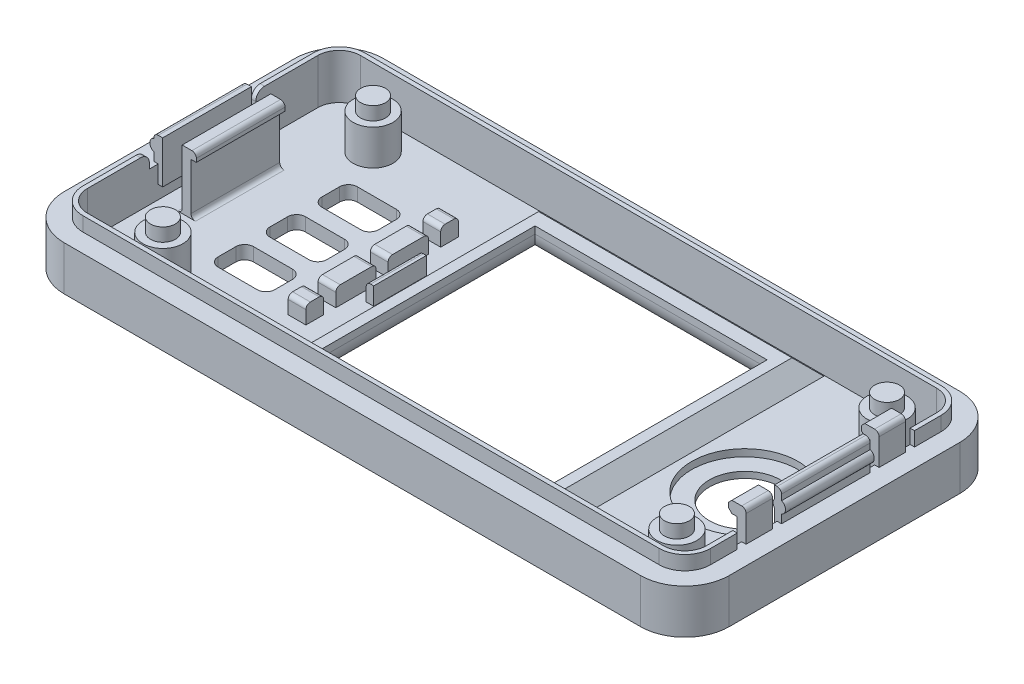
from build123d import *

# Parameters (mm, degrees)
EXTRUDE_2_DEPTH          = 5
EXTRUDE_4_DEPTH          = 1.6
SKETCH_7_W               = 0.5
SKETCH_7_H               = 10
EXTRUDE_8_DEPTH          = 2.8
SKETCH_8_R               = 0.7
EXTRUDE_9_DEPTH          = 10
FILLET_1_R               = 0.5
SKETCH_11_W              = 1
SKETCH_11_H              = 1.6
CUT_EXTRUDE_1_DEPTH      = 1.2
FILLET_2_R               = 1
SKETCH_13_W              = 0.5
SKETCH_13_H              = 10
EXTRUDE_10_DEPTH         = 2.8
CUT_EXTRUDE_START        = -3.5
CUT_EXTRUDE_2_DEPTH      = 3.5
SKETCH_13_2_W            = 0.5
SKETCH_13_2_H            = 10
EXTRUDE_11_DEPTH         = 2
EXTRUDE_12_DEPTH         = 1.6
EXTRUDE_12_DEPTH_BACK    = 2
SKETCH_5_W               = 0.3
SKETCH_5_H               = 10
SKETCH_15_R              = 2.25
EXTRUDE_13_DEPTH         = 4
SKETCH_16_R              = 1.4
EXTRUDE_14_DEPTH         = 1.5
SKETCH_17_W              = 0.5
SKETCH_17_H              = 1
CUT_EXTRUDE_3_DEPTH      = 1.6
SKETCH_19_W              = 0.8
SKETCH_19_H              = 10
EXTRUDE_15_DEPTH         = 1.8
SKETCH_20_R              = 0.7
EXTRUDE_16_DEPTH         = 10
FILLET_4_R               = 0.5
SKETCH_21_W              = 0.5
SKETCH_21_H              = 3
EXTRUDE_17_DEPTH         = 1.9
SKETCH_22_W              = 3
SKETCH_22_H              = 6.3
EXTRUDE_23_DEPTH         = 0.5
FILLET_12_R              = 0.5
SKETCH_29_W              = 0.5
SKETCH_29_H              = 1
CUT_EXTRUDE_5_DEPTH      = 1.6
SKETCH_30_W              = 3
SKETCH_30_H              = 1.3
EXTRUDE_26_DEPTH         = 1
CHAMFER_7_SIZE           = 0.4
SKETCH_24_W              = 1
SKETCH_24_H              = 10
EXTRUDE_27_DEPTH         = 6.7
FILLET_14_R              = 0.5
SKETCH_31_W              = 10
SKETCH_31_H              = 0.9
EXTRUDE_29_DEPTH         = 0.6
FILLET_15_R              = 0.5
SKETCH_27_W              = 28.571240274
SKETCH_27_H              = 28.5
EXTRUDE_31_DEPTH         = 1.8
CUT_EXTRUDE_6_DEPTH      = 1.8
CUT_EXTRUDE_6_DEPTH_BACK = 1.5
SKETCH_26_W              = 26.171240274
SKETCH_26_H              = 25.4
CUT_EXTRUDE_7_DEPTH      = 1.5
SKETCH_33_R              = 6
CUT_EXTRUDE_8_DEPTH      = 0.8
SKETCH_34_R              = 4
CUT_EXTRUDE_9_DEPTH      = 0.8
SKETCH_35_W              = 2
SKETCH_35_H              = 4.55
SKETCH_35_H_2            = 2
SKETCH_35_W_2            = 0.85
SKETCH_35_H_3            = 5.933560664
EXTRUDE_32_DEPTH         = 2
FILLET_16_R              = 0.5
CUT_EXTRUDE_START_2      = -0.5
CUT_EXTRUDE_11_DEPTH     = 0.5
FILLET_17_R              = 2.5


# Read off the part's stored shape, not the designer's step: 切除-拉伸11
# Some blends are built 0.0001 mm under size
with BuildPart() as part:
    # case 2 → 凸台-拉伸2 (new body)
    with BuildSketch(Plane(origin=(0, 0, 0), x_dir=(1, 0, 0), z_dir=(0, 1, 0))):
        with BuildLine():
            Line((-34.042196447, 18), (30.957803553, 18))
            ThreePointArc((30.957803553, 18), (34.493337459, 16.535533906), (35.957803553, 13))
            Line((35.957803553, 13), (35.957803553, -13))
            ThreePointArc((35.957803553, -13), (34.493337459, -16.535533906), (30.957803553, -18))
            Line((30.957803553, -18), (-34.042196447, -18))
            ThreePointArc((-34.042196447, -18), (-37.577730353, -16.535533906), (-39.042196447, -13))
            Line((-39.042196447, -13), (-39.042196447, 13))
            ThreePointArc((-39.042196447, 13), (-37.577730353, 16.535533906), (-34.042196447, 18))
        make_face()
    extrude(amount=EXTRUDE_2_DEPTH)

    # 草图3 → 凸台-拉伸4 (add)
    with BuildSketch(Plane(origin=(0, 5, 0), x_dir=(1, 0, 0), z_dir=(0, 1, 0))):
        with BuildLine():
            Line((-36.942196447, 13), (-36.942196447, -13))
            ThreePointArc((-36.942196447, -13), (-36.092806113, -15.050609665), (-34.042196447, -15.9))
            Line((-34.042196447, -15.9), (30.957803553, -15.9))
            ThreePointArc((30.957803553, -15.9), (33.008413218, -15.050609665), (33.857803553, -13))
            Line((33.857803553, -13), (33.857803553, 13))
            ThreePointArc((33.857803553, 13), (33.008413218, 15.050609665), (30.957803553, 15.9))
            Line((30.957803553, 15.9), (-34.042196447, 15.9))
            ThreePointArc((-34.042196447, 15.9), (-36.092806113, 15.050609665), (-36.942196447, 13))
        make_face()
        with BuildLine():
            Line((-34.042196447, -15.4), (30.957803553, -15.4))
            ThreePointArc((30.957803553, -15.4), (32.654859828, -14.697056275), (33.357803553, -13))
            Line((33.357803553, -13), (33.357803553, 13))
            ThreePointArc((33.357803553, 13), (32.654859828, 14.697056275), (30.957803553, 15.4))
            Line((30.957803553, 15.4), (-34.042196447, 15.4))
            ThreePointArc((-34.042196447, 15.4), (-35.739252722, 14.697056275), (-36.442196447, 13))
            Line((-36.442196447, 13), (-36.442196447, -13))
            ThreePointArc((-36.442196447, -13), (-35.739252722, -14.697056275), (-34.042196447, -15.4))
        make_face(mode=Mode.SUBTRACT)
    extrude(amount=EXTRUDE_4_DEPTH)

    # 草图7 → 凸台-拉伸8 (add)
    with BuildSketch(Plane(origin=(0, 5, 0), x_dir=(1, 0, 0), z_dir=(0, 1, 0))):
        with Locations((-36.692196447, 0)):
            Rectangle(SKETCH_7_W, SKETCH_7_H)
    extrude(amount=EXTRUDE_8_DEPTH)

    # 草图8 → 凸台-拉伸9 (add)
    with BuildSketch(Plane.XY.offset(5)):
        with Locations((-36.692196447, 6.6)):
            Circle(SKETCH_8_R)
    extrude(amount=-EXTRUDE_9_DEPTH)

    # 圆角1
    fillet_1_edges = [part.edges().sort_by_distance(p)[0] for p in [
        (-36.942196447, 7.8, 0),
    ]]
    fillet(fillet_1_edges, radius=FILLET_1_R - 0.0001)  # a hair under: the kernel refuses the full size

    # 草图11 → 切除-拉伸1 (cut)
    with BuildSketch(Plane.ZY.offset(36.942196447)):
        with Locations((5.5, 5.8)):
            Rectangle(SKETCH_11_W, SKETCH_11_H)
        with Locations((-5.5, 5.8)):
            Rectangle(SKETCH_11_W, SKETCH_11_H)
    extrude(amount=-CUT_EXTRUDE_1_DEPTH, mode=Mode.SUBTRACT)

    # 圆角2
    fillet_2_edges = [part.edges().sort_by_distance(p)[0] for p in [
        (-36.692196447, 6.6, 6),
        (-36.692196447, 6.6, -6),
    ]]
    fillet(fillet_2_edges, radius=FILLET_2_R)

    # 草图13 → 凸台-拉伸10 (add)
    with BuildSketch(Plane(origin=(0, 5, 0), x_dir=(1, 0, 0), z_dir=(0, 1, 0))):
        with Locations((-36.192196447, 0)):
            Rectangle(SKETCH_13_W, SKETCH_13_H)
    extrude(amount=EXTRUDE_10_DEPTH)

    # 草图14 → 切除-拉伸2 (cut)
    with BuildSketch(Plane(origin=(0, 5, 0), x_dir=(1, 0, 0), z_dir=(0, 1, 0)).offset(CUT_EXTRUDE_START)):
        with BuildLine():
            Line((-34.042196447, -15.4), (30.957803553, -15.4))
            ThreePointArc((30.957803553, -15.4), (32.654859828, -14.697056275), (33.357803553, -13))
            Line((33.357803553, -13), (33.357803553, 13))
            ThreePointArc((33.357803553, 13), (32.654859828, 14.697056275), (30.957803553, 15.4))
            Line((30.957803553, 15.4), (-34.042196447, 15.4))
            ThreePointArc((-34.042196447, 15.4), (-35.739252722, 14.697056275), (-36.442196447, 13))
            Line((-36.442196447, 13), (-36.442196447, -13))
            ThreePointArc((-36.442196447, -13), (-35.739252722, -14.697056275), (-34.042196447, -15.4))
        make_face()
    extrude(amount=CUT_EXTRUDE_2_DEPTH, mode=Mode.SUBTRACT)

    # 草图13<2> → 凸台-拉伸11 (add)
    with BuildSketch(Plane(origin=(0, 5, 0), x_dir=(1, 0, 0), z_dir=(0, 1, 0))):
        with Locations((-36.192196447, 0)):
            Rectangle(SKETCH_13_2_W, SKETCH_13_2_H)
    extrude(amount=-EXTRUDE_11_DEPTH)

    # 草图5 → 凸台-拉伸12 (add, two sides: drawn at the far end of the back side and taken through both)
    with BuildSketch(Plane(origin=(0, 5, 0), x_dir=(1, 0, 0), z_dir=(0, 1, 0)).offset(-EXTRUDE_12_DEPTH_BACK)):
        with Locations((33.207803553, 0)):
            Rectangle(SKETCH_5_W, SKETCH_5_H)
    extrude(amount=EXTRUDE_12_DEPTH + EXTRUDE_12_DEPTH_BACK)

    # 草图15 → 凸台-拉伸13 (add)
    with BuildSketch(Plane(origin=(0, 1.5, 0), x_dir=(1, 0, 0), z_dir=(0, 1, 0))):
        with Locations(Location((28.957803553, -11.9, 0), (0, 0, 270))):
            Circle(SKETCH_15_R)
        with Locations(Location((-29.012994719, -11.9, 0), (0, 0, 270))):
            Circle(SKETCH_15_R)
        with Locations(Location((28.957803553, 11.8, 0), (0, 0, 270))):
            Circle(SKETCH_15_R)
        with Locations(Location((-29.012994719, 11.8, 0), (0, 0, 270))):
            Circle(SKETCH_15_R)
    extrude(amount=EXTRUDE_13_DEPTH)

    # 草图16 → 凸台-拉伸14 (add)
    with BuildSketch(Plane(origin=(0, 5.5, 0), x_dir=(1, 0, 0), z_dir=(0, 1, 0))):
        with Locations(Location((28.957803553, -11.9, 0), (0, 0, 270))):
            Circle(SKETCH_16_R)
        with Locations(Location((28.957803553, 11.8, 0), (0, 0, 270))):
            Circle(SKETCH_16_R)
        with Locations(Location((-29.012994719, -11.9, 0), (0, 0, 270))):
            Circle(SKETCH_16_R)
        with Locations(Location((-29.012994719, 11.8, 0), (0, 0, 270))):
            Circle(SKETCH_16_R)
    extrude(amount=EXTRUDE_14_DEPTH)

    # 草图17 → 切除-拉伸3 (cut)
    with BuildSketch(Plane(origin=(0, 6.6, 0), x_dir=(1, 0, 0), z_dir=(0, 1, 0))):
        with Locations((33.607803553, -5.5)):
            Rectangle(SKETCH_17_W, SKETCH_17_H)
        with Locations((33.607803553, 5.5)):
            Rectangle(SKETCH_17_W, SKETCH_17_H)
    extrude(amount=-CUT_EXTRUDE_3_DEPTH, mode=Mode.SUBTRACT)

    # 草图19 → 凸台-拉伸15 (add)
    with BuildSketch(Plane(origin=(0, 6.6, 0), x_dir=(1, 0, 0), z_dir=(0, 1, 0))):
        with Locations((33.457803553, 0)):
            Rectangle(SKETCH_19_W, SKETCH_19_H)
    extrude(amount=EXTRUDE_15_DEPTH)

    # 草图20 → 凸台-拉伸16 (add)
    with BuildSketch(Plane(origin=(0, 0, -5), x_dir=(-1, 0, 0), z_dir=(0, 0, -1))):
        with Locations((-33.607803553, 6.6)):
            Circle(SKETCH_20_R)
    extrude(amount=-EXTRUDE_16_DEPTH)

    # 圆角4
    fillet_4_edges = [part.edges().sort_by_distance(p)[0] for p in [
        (33.857803553, 8.4, 0),
    ]]
    fillet(fillet_4_edges, radius=FILLET_4_R)

    # 草图21 → 凸台-拉伸17 (add)
    with BuildSketch(Plane(origin=(0, 6.6, 0), x_dir=(1, 0, 0), z_dir=(0, 1, 0))):
        with Locations((33.607803553, -7.5)):
            Rectangle(SKETCH_21_W, SKETCH_21_H)
        with Locations((33.607803553, 7.5)):
            Rectangle(SKETCH_21_W, SKETCH_21_H)
    extrude(amount=EXTRUDE_17_DEPTH)

    # 草图22 → 凸台-拉伸23 (add)
    with BuildSketch(Plane.ZY.offset(-33.357803553)):
        with Locations((-7.5, 5.35)):
            Rectangle(SKETCH_22_W, SKETCH_22_H)
        with Locations((7.5, 5.35)):
            Rectangle(SKETCH_22_W, SKETCH_22_H)
    extrude(amount=EXTRUDE_23_DEPTH)

    # 圆角12
    fillet_12_edges = [part.edges().sort_by_distance(p)[0] for p in [
        (33.857803553, 8.5, 7.5),
        (33.857803553, 8.5, -7.5),
    ]]
    fillet(fillet_12_edges, radius=FILLET_12_R)

    # 草图29 → 切除-拉伸5 (cut)
    with BuildSketch(Plane(origin=(0, 6.6, 0), x_dir=(1, 0, 0), z_dir=(0, 1, 0))):
        with Locations((33.607803553, -9.5)):
            Rectangle(SKETCH_29_W, SKETCH_29_H)
        with Locations((33.607803553, 9.5)):
            Rectangle(SKETCH_29_W, SKETCH_29_H)
    extrude(amount=-CUT_EXTRUDE_5_DEPTH, mode=Mode.SUBTRACT)

    # 草图30 → 凸台-拉伸26 (add)
    with BuildSketch(Plane.ZY.offset(-32.857803553)):
        with Locations((7.5, 7.85)):
            Rectangle(SKETCH_30_W, SKETCH_30_H)
        with Locations((-7.5, 7.85)):
            Rectangle(SKETCH_30_W, SKETCH_30_H)
    extrude(amount=EXTRUDE_26_DEPTH)

    # 倒角7
    chamfer_7_edges = [part.edges().sort_by_distance(p)[0] for p in [
        (31.857803553, 7.2, 7.5),
        (31.857803553, 8.5, 7.5),
        (31.857803553, 7.2, -7.5),
        (31.857803553, 8.5, -7.5),
    ]]
    chamfer(chamfer_7_edges, length=CHAMFER_7_SIZE)

    # 草图24 → 凸台-拉伸27 (add)
    with BuildSketch(Plane(origin=(0, 1.5, 0), x_dir=(1, 0, 0), z_dir=(0, 1, 0))):
        with Locations((-33.242196447, 0)):
            Rectangle(SKETCH_24_W, SKETCH_24_H)
    extrude(amount=EXTRUDE_27_DEPTH)

    # 圆角14
    fillet_14_edges = [part.edges().sort_by_distance(p)[0] for p in [
        (-33.742196447, 1.5, 0),
        (-32.742196447, 1.5, 0),
    ]]
    fillet(fillet_14_edges, radius=FILLET_14_R)

    # 草图31 → 凸台-拉伸29 (add)
    with BuildSketch(Plane(origin=(-32.742196447, 0, 0), x_dir=(0, 0, -1), z_dir=(1, 0, 0))):
        with Locations((0, 7.75)):
            Rectangle(SKETCH_31_W, SKETCH_31_H)
    extrude(amount=EXTRUDE_29_DEPTH)

    # 圆角15
    fillet_15_edges = [part.edges().sort_by_distance(p)[0] for p in [
        (-32.142196447, 8.2, 0),
    ]]
    fillet(fillet_15_edges, radius=FILLET_15_R)

    # 草图27 → 凸台-拉伸31 (add)
    with BuildSketch(Plane(origin=(0, 1.5, 0), x_dir=(1, 0, 0), z_dir=(0, 1, 0))):
        with Locations((2.24342369, -0.75)):
            Rectangle(SKETCH_27_W, SKETCH_27_H)
    extrude(amount=EXTRUDE_31_DEPTH)

    # 倒角8
    # the kernel refuses this chamfer: 1.8 mm, written as the material it adds along each edge
    with BuildSketch(Plane(origin=(16.529043827, 1.5, -13.5), x_dir=(0, -0.027495876610586382, -0.9996219169112966), z_dir=(-1, 0, 0))) as chamfer_8_piece_1_section:
        with BuildLine():
            Line((1.851611751, 0), (-0.101784879, -1.848812028))
            Line((-0.101784879, -1.848812028), (-0.137771268, -1.847822177))
            ThreePointArc((-0.137771268, -1.847822177), (-0.061432609, -0.924116093), (-0.035986389, 0.000989852))
            Line((-0.035986389, 0.000989852), (0.000989852, 0.035986389))
            ThreePointArc((0.000989852, 0.035986389), (0.926095796, 0.010540169), (1.852601603, 0.035986389))
            Line((1.852601603, 0.035986389), (1.851611751, 0))
        make_face()
    chamfer_8_piece_1 = extrude(amount=28.571240274, mode=Mode.PRIVATE)
    chamfer_8_piece_1 = split(chamfer_8_piece_1, bisect_by=Plane(origin=(2.24342369, 3.3, -14.094727478), z_dir=(0, -1, 0)), keep=Keep.TOP, mode=Mode.PRIVATE)
    add(chamfer_8_piece_1)
    with BuildSketch(Plane(origin=(16.529043827, 1.5, 15), x_dir=(0.9996219169112966, -0.027495876610586382, 0), z_dir=(0, 0, -1))) as chamfer_8_piece_2_section:
        with BuildLine():
            Line((1.851611751, 0), (-0.101784879, -1.848812028))
            Line((-0.101784879, -1.848812028), (-0.137771268, -1.847822177))
            ThreePointArc((-0.137771268, -1.847822177), (-0.061432609, -0.924116093), (-0.035986389, 0.000989852))
            Line((-0.035986389, 0.000989852), (0.000989852, 0.035986389))
            ThreePointArc((0.000989852, 0.035986389), (0.926095796, 0.010540169), (1.852601603, 0.035986389))
            Line((1.852601603, 0.035986389), (1.851611751, 0))
        make_face()
    chamfer_8_piece_2 = extrude(amount=28.5, mode=Mode.PRIVATE)
    chamfer_8_piece_2 = split(chamfer_8_piece_2, bisect_by=Plane(origin=(17.123771305, 3.3, 0.75), z_dir=(0, -1, 0)), keep=Keep.TOP, mode=Mode.PRIVATE)
    add(chamfer_8_piece_2)
    with BuildSketch(Plane(origin=(-12.042196447, 1.5, 15), x_dir=(0, -0.027495876610586382, 0.9996219169112966), z_dir=(1, 0, 0))) as chamfer_8_piece_3_section:
        with BuildLine():
            Line((1.851611751, 0), (-0.101784879, -1.848812028))
            Line((-0.101784879, -1.848812028), (-0.137771268, -1.847822177))
            ThreePointArc((-0.137771268, -1.847822177), (-0.061432609, -0.924116093), (-0.035986389, 0.000989852))
            Line((-0.035986389, 0.000989852), (0.000989852, 0.035986389))
            ThreePointArc((0.000989852, 0.035986389), (0.926095796, 0.010540169), (1.852601603, 0.035986389))
            Line((1.852601603, 0.035986389), (1.851611751, 0))
        make_face()
    chamfer_8_piece_3 = extrude(amount=28.571240274, mode=Mode.PRIVATE)
    chamfer_8_piece_3 = split(chamfer_8_piece_3, bisect_by=Plane(origin=(2.24342369, 3.3, 15.594727478), z_dir=(0, -1, 0)), keep=Keep.TOP, mode=Mode.PRIVATE)
    add(chamfer_8_piece_3)
    with BuildSketch(Plane(origin=(-12.042196447, 1.5, -13.5), x_dir=(-0.9996219169112966, -0.027495876610586382, 0), z_dir=(0, 0, 1))) as chamfer_8_piece_4_section:
        with BuildLine():
            Line((1.851611751, 0), (-0.101784879, -1.848812028))
            Line((-0.101784879, -1.848812028), (-0.137771268, -1.847822177))
            ThreePointArc((-0.137771268, -1.847822177), (-0.061432609, -0.924116093), (-0.035986389, 0.000989852))
            Line((-0.035986389, 0.000989852), (0.000989852, 0.035986389))
            ThreePointArc((0.000989852, 0.035986389), (0.926095796, 0.010540169), (1.852601603, 0.035986389))
            Line((1.852601603, 0.035986389), (1.851611751, 0))
        make_face()
    chamfer_8_piece_4 = extrude(amount=28.5, mode=Mode.PRIVATE)
    chamfer_8_piece_4 = split(chamfer_8_piece_4, bisect_by=Plane(origin=(-12.636923925, 3.3, 0.75), z_dir=(0, -1, 0)), keep=Keep.TOP, mode=Mode.PRIVATE)
    add(chamfer_8_piece_4)
    with BuildSketch(Plane(origin=(21.158073205, 1.5, -13.5), x_dir=(0, -0.027495876610586382, -0.9996219169112966), z_dir=(-1, 0, 0))) as chamfer_8_piece_5a_section:
        with BuildLine():
            Line((1.851611751, 0), (-0.101784879, -1.848812028))
            Line((-0.101784879, -1.848812028), (-0.137771268, -1.847822177))
            ThreePointArc((-0.137771268, -1.847822177), (-0.061432609, -0.924116093), (-0.035986389, 0.000989852))
            Line((-0.035986389, 0.000989852), (0.000989852, 0.035986389))
            ThreePointArc((0.000989852, 0.035986389), (0.926095796, 0.010540169), (1.852601603, 0.035986389))
            Line((1.852601603, 0.035986389), (1.851611751, 0))
        make_face()
    chamfer_8_piece_5a = extrude(amount=33.200269653, mode=Mode.PRIVATE)
    chamfer_8_piece_5a = split(chamfer_8_piece_5a, bisect_by=Plane(origin=(16.529043827, 2.091541801, -14.094727478), z_dir=(1, 0, 0)), keep=Keep.TOP, mode=Mode.PRIVATE)
    chamfer_8_piece_5a = split(chamfer_8_piece_5a, bisect_by=Plane(origin=(18.843558516, 3.3, -14.094727478), z_dir=(0, -1, 0)), keep=Keep.TOP, mode=Mode.PRIVATE)
    with BuildSketch(Plane(origin=(16.529043827, 1.5, 15), x_dir=(0.9996219169112966, -0.027495876610586382, 0), z_dir=(0, 0, -1))) as chamfer_8_piece_5b_section:
        with BuildLine():
            Line((1.851611751, 0), (-0.101784879, -1.848812028))
            Line((-0.101784879, -1.848812028), (-0.137771268, -1.847822177))
            ThreePointArc((-0.137771268, -1.847822177), (-0.061432609, -0.924116093), (-0.035986389, 0.000989852))
            Line((-0.035986389, 0.000989852), (0.000989852, 0.035986389))
            ThreePointArc((0.000989852, 0.035986389), (0.926095796, 0.010540169), (1.852601603, 0.035986389))
            Line((1.852601603, 0.035986389), (1.851611751, 0))
        make_face()
    chamfer_8_piece_5b = extrude(amount=33.129029378, mode=Mode.PRIVATE)
    chamfer_8_piece_5b = split(chamfer_8_piece_5b, bisect_by=Plane(origin=(17.123771305, 2.091541801, -13.5), z_dir=(0, 0, -1)), keep=Keep.TOP, mode=Mode.PRIVATE)
    chamfer_8_piece_5b = split(chamfer_8_piece_5b, bisect_by=Plane(origin=(17.123771305, 3.3, -15.814514689), z_dir=(0, -1, 0)), keep=Keep.TOP, mode=Mode.PRIVATE)
    chamfer_8_piece_5 = chamfer_8_piece_5a & chamfer_8_piece_5b
    add(chamfer_8_piece_5)
    with BuildSketch(Plane(origin=(16.529043827, 1.5, -13.5), x_dir=(0, -0.027495876610586382, -0.9996219169112966), z_dir=(-1, 0, 0))) as chamfer_8_piece_6a_section:
        with BuildLine():
            Line((1.851611751, 0), (-0.101784879, -1.848812028))
            Line((-0.101784879, -1.848812028), (-0.137771268, -1.847822177))
            ThreePointArc((-0.137771268, -1.847822177), (-0.061432609, -0.924116093), (-0.035986389, 0.000989852))
            Line((-0.035986389, 0.000989852), (0.000989852, 0.035986389))
            ThreePointArc((0.000989852, 0.035986389), (0.926095796, 0.010540169), (1.852601603, 0.035986389))
            Line((1.852601603, 0.035986389), (1.851611751, 0))
        make_face()
    chamfer_8_piece_6a = extrude(amount=33.200269653, mode=Mode.PRIVATE)
    chamfer_8_piece_6a = split(chamfer_8_piece_6a, bisect_by=Plane(origin=(-12.042196447, 2.091541801, -14.094727478), z_dir=(-1, 0, 0)), keep=Keep.TOP, mode=Mode.PRIVATE)
    chamfer_8_piece_6a = split(chamfer_8_piece_6a, bisect_by=Plane(origin=(-14.356711136, 3.3, -14.094727478), z_dir=(0, -1, 0)), keep=Keep.TOP, mode=Mode.PRIVATE)
    with BuildSketch(Plane(origin=(-12.042196447, 1.5, -18.129029378), x_dir=(-0.9996219169112966, -0.027495876610586382, 0), z_dir=(0, 0, 1))) as chamfer_8_piece_6b_section:
        with BuildLine():
            Line((1.851611751, 0), (-0.101784879, -1.848812028))
            Line((-0.101784879, -1.848812028), (-0.137771268, -1.847822177))
            ThreePointArc((-0.137771268, -1.847822177), (-0.061432609, -0.924116093), (-0.035986389, 0.000989852))
            Line((-0.035986389, 0.000989852), (0.000989852, 0.035986389))
            ThreePointArc((0.000989852, 0.035986389), (0.926095796, 0.010540169), (1.852601603, 0.035986389))
            Line((1.852601603, 0.035986389), (1.851611751, 0))
        make_face()
    chamfer_8_piece_6b = extrude(amount=33.129029378, mode=Mode.PRIVATE)
    chamfer_8_piece_6b = split(chamfer_8_piece_6b, bisect_by=Plane(origin=(-12.636923925, 2.091541801, -13.5), z_dir=(0, 0, -1)), keep=Keep.TOP, mode=Mode.PRIVATE)
    chamfer_8_piece_6b = split(chamfer_8_piece_6b, bisect_by=Plane(origin=(-12.636923925, 3.3, -15.814514689), z_dir=(0, -1, 0)), keep=Keep.TOP, mode=Mode.PRIVATE)
    chamfer_8_piece_6 = chamfer_8_piece_6a & chamfer_8_piece_6b
    add(chamfer_8_piece_6)
    with BuildSketch(Plane(origin=(-12.042196447, 1.5, 15), x_dir=(0, -0.027495876610586382, 0.9996219169112966), z_dir=(1, 0, 0))) as chamfer_8_piece_7a_section:
        with BuildLine():
            Line((1.851611751, 0), (-0.101784879, -1.848812028))
            Line((-0.101784879, -1.848812028), (-0.137771268, -1.847822177))
            ThreePointArc((-0.137771268, -1.847822177), (-0.061432609, -0.924116093), (-0.035986389, 0.000989852))
            Line((-0.035986389, 0.000989852), (0.000989852, 0.035986389))
            ThreePointArc((0.000989852, 0.035986389), (0.926095796, 0.010540169), (1.852601603, 0.035986389))
            Line((1.852601603, 0.035986389), (1.851611751, 0))
        make_face()
    chamfer_8_piece_7a = extrude(amount=33.200269653, mode=Mode.PRIVATE)
    chamfer_8_piece_7a = split(chamfer_8_piece_7a, bisect_by=Plane(origin=(16.529043827, 2.091541801, 15.594727478), z_dir=(1, 0, 0)), keep=Keep.TOP, mode=Mode.PRIVATE)
    chamfer_8_piece_7a = split(chamfer_8_piece_7a, bisect_by=Plane(origin=(18.843558516, 3.3, 15.594727478), z_dir=(0, -1, 0)), keep=Keep.TOP, mode=Mode.PRIVATE)
    with BuildSketch(Plane(origin=(16.529043827, 1.5, 19.629029378), x_dir=(0.9996219169112966, -0.027495876610586382, 0), z_dir=(0, 0, -1))) as chamfer_8_piece_7b_section:
        with BuildLine():
            Line((1.851611751, 0), (-0.101784879, -1.848812028))
            Line((-0.101784879, -1.848812028), (-0.137771268, -1.847822177))
            ThreePointArc((-0.137771268, -1.847822177), (-0.061432609, -0.924116093), (-0.035986389, 0.000989852))
            Line((-0.035986389, 0.000989852), (0.000989852, 0.035986389))
            ThreePointArc((0.000989852, 0.035986389), (0.926095796, 0.010540169), (1.852601603, 0.035986389))
            Line((1.852601603, 0.035986389), (1.851611751, 0))
        make_face()
    chamfer_8_piece_7b = extrude(amount=33.129029378, mode=Mode.PRIVATE)
    chamfer_8_piece_7b = split(chamfer_8_piece_7b, bisect_by=Plane(origin=(17.123771305, 2.091541801, 15), z_dir=(0, 0, 1)), keep=Keep.TOP, mode=Mode.PRIVATE)
    chamfer_8_piece_7b = split(chamfer_8_piece_7b, bisect_by=Plane(origin=(17.123771305, 3.3, 17.314514689), z_dir=(0, -1, 0)), keep=Keep.TOP, mode=Mode.PRIVATE)
    chamfer_8_piece_7 = chamfer_8_piece_7a & chamfer_8_piece_7b
    add(chamfer_8_piece_7)
    with BuildSketch(Plane(origin=(-12.042196447, 1.5, -13.5), x_dir=(-0.9996219169112966, -0.027495876610586382, 0), z_dir=(0, 0, 1))) as chamfer_8_piece_8a_section:
        with BuildLine():
            Line((1.851611751, 0), (-0.101784879, -1.848812028))
            Line((-0.101784879, -1.848812028), (-0.137771268, -1.847822177))
            ThreePointArc((-0.137771268, -1.847822177), (-0.061432609, -0.924116093), (-0.035986389, 0.000989852))
            Line((-0.035986389, 0.000989852), (0.000989852, 0.035986389))
            ThreePointArc((0.000989852, 0.035986389), (0.926095796, 0.010540169), (1.852601603, 0.035986389))
            Line((1.852601603, 0.035986389), (1.851611751, 0))
        make_face()
    chamfer_8_piece_8a = extrude(amount=33.129029378, mode=Mode.PRIVATE)
    chamfer_8_piece_8a = split(chamfer_8_piece_8a, bisect_by=Plane(origin=(-12.636923925, 2.091541801, 15), z_dir=(0, 0, 1)), keep=Keep.TOP, mode=Mode.PRIVATE)
    chamfer_8_piece_8a = split(chamfer_8_piece_8a, bisect_by=Plane(origin=(-12.636923925, 3.3, 17.314514689), z_dir=(0, -1, 0)), keep=Keep.TOP, mode=Mode.PRIVATE)
    with BuildSketch(Plane(origin=(-16.671225826, 1.5, 15), x_dir=(0, -0.027495876610586382, 0.9996219169112966), z_dir=(1, 0, 0))) as chamfer_8_piece_8b_section:
        with BuildLine():
            Line((1.851611751, 0), (-0.101784879, -1.848812028))
            Line((-0.101784879, -1.848812028), (-0.137771268, -1.847822177))
            ThreePointArc((-0.137771268, -1.847822177), (-0.061432609, -0.924116093), (-0.035986389, 0.000989852))
            Line((-0.035986389, 0.000989852), (0.000989852, 0.035986389))
            ThreePointArc((0.000989852, 0.035986389), (0.926095796, 0.010540169), (1.852601603, 0.035986389))
            Line((1.852601603, 0.035986389), (1.851611751, 0))
        make_face()
    chamfer_8_piece_8b = extrude(amount=33.200269653, mode=Mode.PRIVATE)
    chamfer_8_piece_8b = split(chamfer_8_piece_8b, bisect_by=Plane(origin=(-12.042196447, 2.091541801, 15.594727478), z_dir=(-1, 0, 0)), keep=Keep.TOP, mode=Mode.PRIVATE)
    chamfer_8_piece_8b = split(chamfer_8_piece_8b, bisect_by=Plane(origin=(-14.356711136, 3.3, 15.594727478), z_dir=(0, -1, 0)), keep=Keep.TOP, mode=Mode.PRIVATE)
    chamfer_8_piece_8 = chamfer_8_piece_8a & chamfer_8_piece_8b
    add(chamfer_8_piece_8)

    # 草图26 → 切除-拉伸6 (cut, two sides: drawn at the far end of the back side and taken through both)
    with BuildSketch(Plane(origin=(0, 1.5, 0), x_dir=(1, 0, 0), z_dir=(0, 1, 0)).offset(-CUT_EXTRUDE_6_DEPTH_BACK)):
        with Locations((2.24342369, -0.8)):
            Rectangle(SKETCH_26_W, SKETCH_26_H)
    extrude(amount=CUT_EXTRUDE_6_DEPTH + CUT_EXTRUDE_6_DEPTH_BACK, mode=Mode.SUBTRACT)

    # 草图32 → 切除-拉伸7 (cut)
    with BuildSketch(Plane.XZ):
        with BuildLine():
            Line((-26.492196447, 8.2), (-22.092196447, 8.2))
            ThreePointArc((-22.092196447, 8.2), (-21.385089666, 7.907106781), (-21.092196447, 7.2))
            Line((-21.092196447, 7.2), (-21.092196447, 5.2))
            ThreePointArc((-21.092196447, 5.2), (-21.385089666, 4.492893219), (-22.092196447, 4.2))
            Line((-22.092196447, 4.2), (-26.492196447, 4.2))
            ThreePointArc((-26.492196447, 4.2), (-27.199303228, 4.492893219), (-27.492196447, 5.2))
            Line((-27.492196447, 5.2), (-27.492196447, 7.2))
            ThreePointArc((-27.492196447, 7.2), (-27.199303228, 7.907106781), (-26.492196447, 8.2))
        make_face()
        with BuildLine():
            Line((-26.492196447, 2.35), (-22.092196447, 2.35))
            ThreePointArc((-22.092196447, 2.35), (-21.385089666, 2.057106781), (-21.092196447, 1.35))
            Line((-21.092196447, 1.35), (-21.092196447, -0.65))
            ThreePointArc((-21.092196447, -0.65), (-21.385089666, -1.357106781), (-22.092196447, -1.65))
            Line((-22.092196447, -1.65), (-26.492196447, -1.65))
            ThreePointArc((-26.492196447, -1.65), (-27.199303228, -1.357106781), (-27.492196447, -0.65))
            Line((-27.492196447, -0.65), (-27.492196447, 1.35))
            ThreePointArc((-27.492196447, 1.35), (-27.199303228, 2.057106781), (-26.492196447, 2.35))
        make_face()
        with BuildLine():
            Line((-26.492196447, -3.5), (-22.092196447, -3.5))
            ThreePointArc((-22.092196447, -3.5), (-21.385089666, -3.792893219), (-21.092196447, -4.5))
            Line((-21.092196447, -4.5), (-21.092196447, -6.5))
            ThreePointArc((-21.092196447, -6.5), (-21.385089666, -7.207106781), (-22.092196447, -7.5))
            Line((-22.092196447, -7.5), (-26.492196447, -7.5))
            ThreePointArc((-26.492196447, -7.5), (-27.199303228, -7.207106781), (-27.492196447, -6.5))
            Line((-27.492196447, -6.5), (-27.492196447, -4.5))
            ThreePointArc((-27.492196447, -4.5), (-27.199303228, -3.792893219), (-26.492196447, -3.5))
        make_face()
    extrude(amount=-CUT_EXTRUDE_7_DEPTH, mode=Mode.SUBTRACT)

    # 草图33 → 切除-拉伸8 (cut)
    with BuildSketch(Plane(origin=(0, 1.5, 0), x_dir=(1, 0, 0), z_dir=(0, 1, 0))):
        with Locations(Location((25.192825281, -0.466537229, 0), (0, 0, 270))):
            Circle(SKETCH_33_R)
    extrude(amount=-CUT_EXTRUDE_8_DEPTH, mode=Mode.SUBTRACT)

    # 草图34 → 切除-拉伸9 (cut)
    with BuildSketch(Plane(origin=(0, 0.7, 0), x_dir=(1, 0, 0), z_dir=(0, 1, 0))):
        with Locations(Location((25.192825281, -0.466537229, 0), (0, 0, 270))):
            Circle(SKETCH_34_R)
    extrude(amount=-CUT_EXTRUDE_9_DEPTH, mode=Mode.SUBTRACT)

    # 草图35 → 凸台-拉伸32 (add)
    with BuildSketch(Plane(origin=(0, 1.5, 0), x_dir=(1, 0, 0), z_dir=(0, 1, 0))):
        with Locations((-16.881494442, -3.259142578)):
            Rectangle(SKETCH_35_W, SKETCH_35_H)
        with Locations((-16.881494442, 2.640857422)):
            Rectangle(SKETCH_35_W, SKETCH_35_H)
        with Locations((-16.881494442, -7.904142578)):
            Rectangle(SKETCH_35_W, SKETCH_35_H_2)
        with Locations((-14.306494442, -0.287362246)):
            Rectangle(SKETCH_35_W_2, SKETCH_35_H_3)
        with Locations((-16.881494442, 7.295857422)):
            Rectangle(SKETCH_35_W, SKETCH_35_H_2)
    extrude(amount=EXTRUDE_32_DEPTH)

    # 圆角16
    fillet_16_edges = [part.edges().sort_by_distance(p)[0] for p in [
        (-16.881494442, 3.5, 5.534142578),
        (-16.881494442, 3.5, 0.984142578),
        (-16.881494442, 3.5, -0.365857422),
        (-16.881494442, 3.5, -4.915857422),
        (-16.881494442, 3.5, 8.904142578),
        (-16.881494442, 3.5, 6.904142578),
        (-14.731494442, 3.5, 0.287362246),
        (-16.881494442, 3.5, -6.295857422),
        (-16.881494442, 3.5, -8.295857422),
    ]]
    fillet(fillet_16_edges, radius=FILLET_16_R)

    # 切除-拉伸11 outline → 切除-拉伸11 (cut)
    with BuildSketch(Plane.XZ.offset(CUT_EXTRUDE_START_2)):
        with BuildLine():
            Line((-33.234161348, -14.51479109), (-32.946609498, -14.682541858))
            add(Edge.make_bspline(
                [(-32.946609498, -14.682541858), (-32.852733423, -14.734452816), (-32.748911507, -14.762413309), (-32.541218919, -14.762413309), (-32.437372625, -14.734452816), (-32.343520928, -14.682541858)],
                knots=[3, 3, 3, 3, 4, 4, 5, 5, 5, 5], degree=3))
            Line((-32.343520928, -14.682541858), (-32.055944701, -14.51479109))
            Line((-32.055944701, -14.51479109), (-30.564214631, -13.654097894))
            Line((-30.564214631, -13.654097894), (-30.276638404, -13.488346046))
            add(Edge.make_bspline(
                [(-30.276638404, -13.488346046), (-30.090933928, -13.380514102), (-29.975094119, -13.180817192), (-29.975094119, -12.967140035)],
                knots=[8, 8, 8, 8, 9, 9, 9, 9], degree=3))
            Line((-29.975094119, -12.967140035), (-29.975094119, -10.578760599))
            add(Edge.make_bspline(
                [(-29.975094119, -10.578760599), (-29.975094119, -10.363096712), (-30.090933928, -10.165386532), (-30.276638404, -10.057554588)],
                knots=[10, 10, 10, 10, 11, 11, 11, 11], degree=3))
            Line((-30.276638404, -10.057554588), (-30.564214631, -9.89180274))
            Line((-30.564214631, -9.89180274), (-32.055944701, -9.031109544))
            Line((-32.055944701, -9.031109544), (-32.343520928, -8.863370964))
            add(Edge.make_bspline(
                [(-32.343520928, -8.863370964), (-32.437372625, -8.809448898), (-32.541218919, -8.783487325), (-32.748911507, -8.783487325), (-32.852733423, -8.809448898), (-32.946609498, -8.863370964)],
                knots=[14, 14, 14, 14, 15, 15, 16, 16, 16, 16], degree=3))
            Line((-32.946609498, -8.863370964), (-33.234161348, -9.031109544))
            Line((-33.234161348, -9.031109544), (-34.725891418, -9.89180274))
            Line((-34.725891418, -9.89180274), (-35.013443268, -10.057554588))
            add(Edge.make_bspline(
                [(-35.013443268, -10.057554588), (-35.201171039, -10.165386532), (-35.314987552, -10.363096712), (-35.314987552, -10.578760599)],
                knots=[19, 19, 19, 19, 20, 20, 20, 20], degree=3))
            Line((-35.314987552, -10.578760599), (-35.314987552, -12.967140035))
            add(Edge.make_bspline(
                [(-35.314987552, -12.967140035), (-35.314987552, -13.180817192), (-35.201171039, -13.380514102), (-35.013443268, -13.488346046)],
                knots=[21, 21, 21, 21, 22, 22, 22, 22], degree=3))
            Line((-35.013443268, -13.488346046), (-34.725891418, -13.654097894))
            Line((-34.725891418, -13.654097894), (-33.234161348, -14.51479109))
        make_face()
        with BuildLine():
            add(Edge.make_bspline(
                [(-32.451340683, -11.93670934), (-32.571153954, -11.866808109), (-32.720926637, -11.866808109), (-32.840764285, -11.93670934)],
                knots=[7, 7, 7, 7, 8, 8, 8, 8], degree=3))
            add(Edge.make_bspline(
                [(-30.642099351, -12.981120281), (-30.64609719, -12.979121362), (-32.451340683, -11.93670934)],
                knots=[0, 0, 0, 1, 1, 1], degree=2))
            add(Edge.make_bspline(
                [(-30.660065248, -13.250706235), (-30.558217873, -13.192798519), (-30.548247654, -13.049010405), (-30.642099351, -12.981120281)],
                knots=[1, 1, 1, 1, 2, 2, 2, 2], degree=3))
            Line((-30.660065248, -13.250706235), (-32.505262749, -14.317093099))
            add(Edge.make_bspline(
                [(-32.786842219, -14.317093099), (-32.698987279, -14.367017327), (-32.591143147, -14.367017327), (-32.505262749, -14.317093099)],
                knots=[3, 3, 3, 3, 4, 4, 4, 4], degree=3))
            Line((-32.786842219, -14.317093099), (-34.622045124, -13.248707316))
            add(Edge.make_bspline(
                [(-34.624044043, -13.003084016), (-34.717895741, -13.059005002), (-34.715896821, -13.194797438), (-34.622045124, -13.248707316)],
                knots=[5, 5, 5, 5, 6, 6, 6, 6], degree=3))
            Line((-34.624044043, -13.003084016), (-32.840764285, -11.93670934))
        make_face(mode=Mode.SUBTRACT)
        with BuildLine():
            add(Edge.make_bspline(
                [(-34.552156081, -11.784937738), (-34.396411017, -11.69707061), (-34.286567966, -11.53731552), (-34.286567966, -11.395526325), (-34.286567966, -11.25773497), (-34.396411017, -11.219792069), (-34.552156081, -11.309658117)],
                knots=[0, 0, 0, 0, 1, 1, 1, 2, 2, 2, 2], degree=3))
            add(Edge.make_bspline(
                [(-34.552156081, -11.309658117), (-34.705926602, -11.395526325), (-34.815745276, -11.557280335), (-34.815745276, -11.695071691), (-34.815745276, -11.834861966), (-34.705926602, -11.872804867), (-34.552156081, -11.784937738)],
                knots=[2, 2, 2, 2, 3, 3, 3, 4, 4, 4, 4], degree=3))
        make_face(mode=Mode.SUBTRACT)
        with BuildLine():
            add(Edge.make_bspline(
                [(-34.76182321, -10.25325366), (-34.773816726, -10.259250418), (-34.781812403, -10.273230664), (-34.781812403, -10.287210911)],
                knots=[0, 0, 0, 0, 1, 1, 1, 1], degree=3))
            Line((-34.76182321, -10.25325366), (-34.378420744, -10.035590853))
            add(Edge.make_bspline(
                [(-34.320500839, -10.069535915), (-34.320500839, -10.039588692), (-34.35245917, -10.021610607), (-34.378420744, -10.035590853)],
                knots=[2, 2, 2, 2, 3, 3, 3, 3], degree=3))
            Line((-34.320500839, -10.069535915), (-34.320500839, -10.950206116))
            add(Edge.make_bspline(
                [(-34.340490032, -10.984151178), (-34.328496516, -10.976167689), (-34.320500839, -10.964174173), (-34.320500839, -10.950206116)],
                knots=[4, 4, 4, 4, 5, 5, 5, 5], degree=3))
            Line((-34.340490032, -10.984151178), (-34.723892498, -11.199827254))
            add(Edge.make_bspline(
                [(-34.781812403, -11.165870003), (-34.781812403, -11.195829415), (-34.749854072, -11.213795311), (-34.723892498, -11.199827254)],
                knots=[6, 6, 6, 6, 7, 7, 7, 7], degree=3))
            Line((-34.781812403, -11.165870003), (-34.781812403, -10.287210911))
        make_face(mode=Mode.SUBTRACT)
        with BuildLine():
            add(Edge.make_bspline(
                [(-33.369941596, -10.484908902), (-33.597623376, -10.61271785), (-33.705443131, -10.780456429), (-33.705443131, -11.165870003), (-33.581632022, -11.163871084), (-33.357972457, -11.036074324)],
                knots=[0, 0, 0, 0, 1, 1, 2.031545133, 2.031545133, 2.031545133, 2.031545133], degree=3))
            Line((-33.357972457, -11.036074324), (-33.186236039, -10.940211519))
            add(Edge.make_bspline(
                [(-33.166246847, -10.906266457), (-33.166246847, -10.920246704), (-33.174242524, -10.93422695), (-33.186236039, -10.940211519)],
                knots=[4, 4, 4, 4, 5, 5, 5, 5], degree=3))
            Line((-33.166246847, -10.906266457), (-33.166246847, -9.380579137))
            add(Edge.make_bspline(
                [(-33.146306408, -9.346634075), (-33.160274466, -9.354617563), (-33.166246847, -9.36659889), (-33.166246847, -9.380579137)],
                knots=[3, 3, 3, 3, 4, 4, 4, 4], degree=3))
            Line((-33.146306408, -9.346634075), (-32.758881726, -9.126972349))
            add(Edge.make_bspline(
                [(-32.700961821, -9.160917411), (-32.700961821, -9.130957999), (-32.732920152, -9.112992102), (-32.758881726, -9.126972349)],
                knots=[5, 5, 5, 5, 6, 6, 6, 6], degree=3))
            Line((-32.700961821, -9.160917411), (-32.700961821, -11.010112751))
            add(Edge.make_bspline(
                [(-32.720926637, -11.044057813), (-32.706958579, -11.038073244), (-32.700961821, -11.024092997), (-32.700961821, -11.010112751)],
                knots=[7, 7, 7, 7, 8, 8, 8, 8], degree=3))
            Line((-32.720926637, -11.044057813), (-33.379936192, -11.41749006))
            add(Edge.make_bspline(
                [(-33.379936192, -11.41749006), (-33.807290505, -11.65912771), (-34.16073356, -11.707053018), (-34.16073356, -10.766476182), (-33.803292667, -10.361097792), (-33.393928627, -10.129442551)],
                knots=[9, 9, 9, 9, 10, 10, 10.962489192, 10.962489192, 10.962489192, 10.962489192], degree=3))
            Line((-33.393928627, -10.129442551), (-33.186236039, -10.013627118))
            Line((-33.186236039, -10.013627118), (-33.186236039, -10.393043935))
            Line((-33.186236039, -10.393043935), (-33.369941596, -10.484908902))
        make_face(mode=Mode.SUBTRACT)
    extrude(amount=CUT_EXTRUDE_11_DEPTH, mode=Mode.SUBTRACT)

    # 圆角17
    fillet_17_edges = [part.edges().sort_by_distance(p)[0] for p in [
        (-10.842196447, 0, 0.8),
        (2.24342369, 0, 13.5),
        (15.329043827, 0, 0.8),
        (2.24342369, 0, -11.9),
    ]]
    fillet(fillet_17_edges, radius=FILLET_17_R)


solid = part.part
